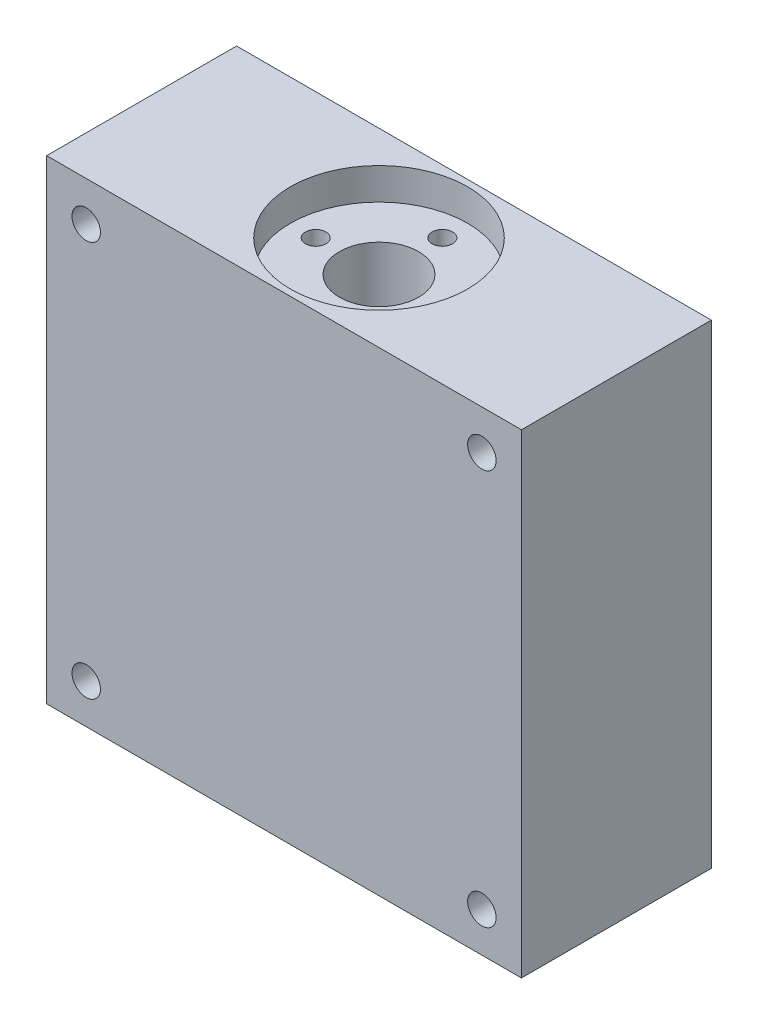
from build123d import *

# Parameters (mm, degrees)
SKETCH1_W           = 60
SKETCH1_H           = 60
SKETCH1_R           = 1.8
BOSS_EXTRUDE1_DEPTH = 24
SKETCH2_R           = 11.2
CUT_EXTRUDE1_DEPTH  = 4
CUT_EXTRUDE2_REACH  = 69.912
SKETCH3_R           = 5
SKETCH4_R           = 7.2
CUT_EXTRUDE3_DEPTH  = 46
SKETCH5_R           = 1.3
CUT_EXTRUDE4_DEPTH  = 6


with BuildPart() as part:
    # Sketch1 → Boss-Extrude1 (new body)
    with BuildSketch(Plane.XY):
        Rectangle(SKETCH1_W, SKETCH1_H)
        with Locations((-25, 25)):
            Circle(SKETCH1_R, mode=Mode.SUBTRACT)
        with Locations((25, 25)):
            Circle(SKETCH1_R, mode=Mode.SUBTRACT)
        with Locations((25, -25)):
            Circle(SKETCH1_R, mode=Mode.SUBTRACT)
        with Locations((-25, -25)):
            Circle(SKETCH1_R, mode=Mode.SUBTRACT)
    extrude(amount=BOSS_EXTRUDE1_DEPTH)

    # Sketch2 → Cut-Extrude1 (cut)
    with BuildSketch(Plane(origin=(0, 30, 0), x_dir=(1, 0, 0), z_dir=(0, 1, 0))):
        with Locations((0, -12)):
            Circle(SKETCH2_R)
    extrude(amount=-CUT_EXTRUDE1_DEPTH, mode=Mode.SUBTRACT)

    # Sketch3 → Cut-Extrude2 (cut, up to next)
    with BuildSketch(Plane(origin=(0, 26, 0), x_dir=(1, 0, 0), z_dir=(0, 1, 0)), mode=Mode.PRIVATE) as cut_extrude2_sk1:
        with Locations((0, -12)):
            Circle(SKETCH3_R)
    cut_extrude2_tool1 = extrude(cut_extrude2_sk1.sketch, amount=-CUT_EXTRUDE2_REACH, mode=Mode.PRIVATE) & part.part
    add(cut_extrude2_tool1.solids().sort_by_distance((0, 26, 12))[0], mode=Mode.SUBTRACT)

    # Sketch4 → Cut-Extrude3 (cut)
    with BuildSketch(Plane.XZ.offset(30)):
        with Locations((0, 12)):
            Circle(SKETCH4_R)
    extrude(amount=-CUT_EXTRUDE3_DEPTH, mode=Mode.SUBTRACT)

    # Sketch5 → Cut-Extrude4 (cut)
    with BuildSketch(Plane(origin=(0, 26, 0), x_dir=(1, 0, 0), z_dir=(0, 1, 0))):
        with Locations((0, -4)):
            Circle(SKETCH5_R)
        with Locations((8, -12)):
            Circle(SKETCH5_R)
        with Locations((0, -20)):
            Circle(SKETCH5_R)
        with Locations((-8, -12)):
            Circle(SKETCH5_R)
    extrude(amount=-CUT_EXTRUDE4_DEPTH, mode=Mode.SUBTRACT)


solid = part.part
